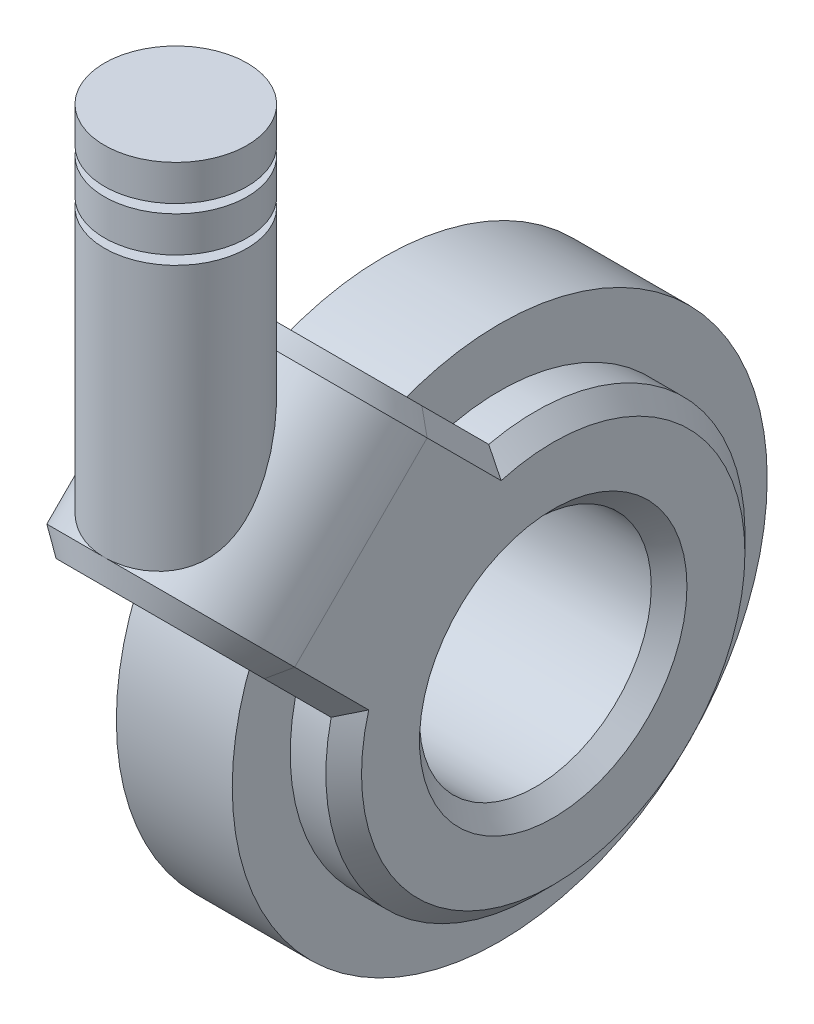
from build123d import *

# Parameters (mm, degrees)
SKETCH1_R           = 30
SKETCH1_R_2         = 13.5
BOSS_EXTRUDE1_DEPTH = 6.5
SKETCH2_R           = 23.5
SKETCH2_R_2         = 13
BOSS_EXTRUDE2_DEPTH = 12.5
BOSS_EXTRUDE3_DEPTH = 12.5
CHAMFER1_SIZE       = 2
BOSS_EXTRUDE4_REACH = 94.067
SKETCH5_R           = 8


with BuildPart() as part:
    # Sketch1 → Boss-Extrude1 (new, symmetric)
    with BuildSketch(Plane(origin=(0, 0, 0), x_dir=(0, 0, -1), z_dir=(1, 0, 0))):
        Circle(SKETCH1_R)
        Circle(SKETCH1_R_2, mode=Mode.SUBTRACT)
    extrude(amount=BOSS_EXTRUDE1_DEPTH, both=True)


with BuildPart() as body_2:
    # Sketch2 → Boss-Extrude2 (new, symmetric)
    with BuildSketch(Plane(origin=(0, 0, 0), x_dir=(0, 0, -1), z_dir=(1, 0, 0))):
        Circle(SKETCH2_R)
        Circle(SKETCH2_R_2, mode=Mode.SUBTRACT)
    extrude(amount=BOSS_EXTRUDE2_DEPTH, both=True)

    # Sketch4 → Boss-Extrude3 (add, symmetric)
    with BuildSketch(Plane(origin=(0, 0, 0), x_dir=(-1, 0, 0), z_dir=(0, 0.7071067811865475, -0.7071067811865477))):
        with BuildLine():
            Line((-12.5, 18.5), (-12.5, 30.5))
            ThreePointArc((-12.5, 30.5), (0, 43), (12.5, 30.5))
            Line((12.5, 30.5), (12.5, 18.5))
            Line((12.5, 18.5), (7.5, 18.5))
            Line((7.5, 18.5), (7.5, 30.5))
            ThreePointArc((7.5, 30.5), (0, 38), (-7.5, 30.5))
            Line((-7.5, 30.5), (-7.5, 18.5))
            Line((-7.5, 18.5), (-12.5, 18.5))
        make_face()
    extrude(amount=BOSS_EXTRUDE3_DEPTH, both=True)

    # Chamfer1
    chamfer1_edges = [body_2.edges().sort_by_distance(p)[0] for p in [
        (-12.5, 0, 13),
        (-12.5, 26.657836818, 8.980167288),
        (-12.5, 8.980167288, 26.657836818),
        (-12.5, -23.352054814, 2.632781035),
        (12.5, 0, 13),
        (0, 21.566756826, 39.244426356),
        (0, 39.244426356, 21.566756826),
        (12.5, 8.980167288, 26.657836818),
        (12.5, 26.657836818, 8.980167288),
        (12.5, -23.352054814, 2.632781035),
    ]]
    chamfer(chamfer1_edges, length=CHAMFER1_SIZE)

    # Sketch5 → Boss-Extrude4 (add, up to next)
    with BuildSketch(Plane(origin=(0, 53, 0), x_dir=(1, 0, 0), z_dir=(0, 1, 0)), mode=Mode.PRIVATE) as boss_extrude4_sk1:
        with Locations((0, -29.830212793)):
            Circle(SKETCH5_R)
    boss_extrude4_tool1 = extrude(boss_extrude4_sk1.sketch, amount=-BOSS_EXTRUDE4_REACH, mode=Mode.PRIVATE) - body_2.part
    add(boss_extrude4_tool1.solids().sort_by_distance((0, 53, 29.830213))[0])

    # Sketch6 → Revolve1 (revolve)
    with BuildSketch(Plane(origin=(0, 0, 0), x_dir=(0, 0, -1), z_dir=(1, 0, 0))):
        Polygon((-29.830212793, 53), (-29.830212793, 63), (-21.830212793, 63), (-21.830212793, 59), (-23.830212793, 59), (-23.830212793, 58), (-21.830212793, 58), (-21.830212793, 54), (-23.830212793, 54), (-23.830212793, 53), align=None)
    revolve(axis=Axis((0, 53, 29.830212793), (0, 1, 0)))


solid = Compound([part.part, body_2.part])
